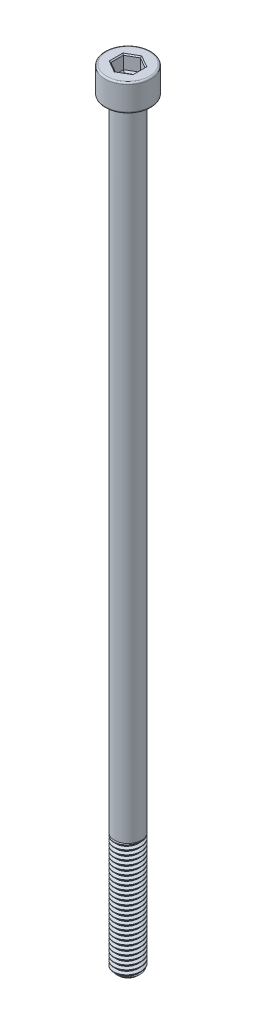
from build123d import *

# Parameters (mm, degrees)
SKETCH1_R           = 2.5
BOSS_EXTRUDE1_DEPTH = 22
THREAD1_PITCH       = 0.8
SKETCH2_R           = 2.5
BOSS_EXTRUDE2_DEPTH = 118
SKETCH3_R           = 4.25
BOSS_EXTRUDE3_DEPTH = 5
FILLET1_R           = 0.3
CUT_EXTRUDE1_DEPTH  = 2.5
CHAMFER1_SIZE       = 0.2
CUT_EXTRUDE2_DEPTH  = 0.3
CUT_EXTRUDE2_DRAFT  = -45


with BuildPart() as part:
    # Sketch1 → Boss-Extrude1 (new body)
    with BuildSketch(Plane(origin=(0, 0, 0), x_dir=(1, 0, 0), z_dir=(0, 1, 0))):
        with Locations(Location((0, 0, 0), (0, 0, 270))):
            Circle(SKETCH1_R)
    extrude(amount=BOSS_EXTRUDE1_DEPTH)

    # Thread1: the profile of Thread Profile1 profile screwed along a right-hand helix of 28.75 turns, 8 arcs to a turn; built about Z, then put on its axis
    thread1_z = Axis((0, 0, 0), (0, 0, 1))
    thread1_corners = [(2.5003, 0, -0.000173205), (2.5003, 0, 0.700173203), (2.0669873, 0, 0.449999999), (2.0669873, 0, 0.249999999)]
    with BuildLine(mode=Mode.PRIVATE) as thread1_profile:
        Line(thread1_corners[0], thread1_corners[1])
        Line(thread1_corners[1], thread1_corners[2])
        Line(thread1_corners[2], thread1_corners[3])
        Line(thread1_corners[3], thread1_corners[0])
    thread1_cap = Face(thread1_profile.wire())
    thread1_turn_angles = [0, 22.5, 45, 67.5, 90, 112.5, 135, 157.5, 180, 202.5, 225, 247.5, 270, 292.5, 315, 337.5, 360]
    thread1_turn_weights = [1, 0.9238795325112867, 1, 0.9238795325112867, 1, 0.9238795325112867, 1, 0.9238795325112867, 1, 0.9238795325112867, 1, 0.9238795325112867, 1, 0.9238795325112867, 1, 0.9238795325112867, 1]
    thread1_turn_rails = [Edge.make_bspline([Vector(p[0], p[1], 0).rotate(thread1_z, thread1_turn_angles[k]) / thread1_turn_weights[k] + Vector(0, 0, p[2] + THREAD1_PITCH * thread1_turn_angles[k] / 360) for k in range(17)], [0, 0, 0, 1, 1, 2, 2, 3, 3, 4, 4, 5, 5, 6, 6, 7, 7, 8, 8, 8], 2, thread1_turn_weights) for p in thread1_corners]
    thread1_turn_sides = [Face.make_surface_from_curves(thread1_turn_rails[p[0]], thread1_turn_rails[p[1]]) for p in [(0, 1), (1, 2), (2, 3), (3, 0)]]
    thread1_last_angles = [10080, 10102.5, 10125, 10147.5, 10170, 10192.5, 10215, 10237.5, 10260, 10282.5, 10305, 10327.5, 10350]
    thread1_last_weights = [1, 0.9238795325112867, 1, 0.9238795325112867, 1, 0.9238795325112867, 1, 0.9238795325112867, 1, 0.9238795325112867, 1, 0.9238795325112867, 1]
    thread1_last_rails = [Edge.make_bspline([Vector(p[0], p[1], 0).rotate(thread1_z, thread1_last_angles[k]) / thread1_last_weights[k] + Vector(0, 0, p[2] + THREAD1_PITCH * thread1_last_angles[k] / 360) for k in range(13)], [0, 0, 0, 1, 1, 2, 2, 3, 3, 4, 4, 5, 5, 6, 6, 6], 2, thread1_last_weights) for p in thread1_corners]
    thread1_last_sides = [Face.make_surface_from_curves(thread1_last_rails[p[0]], thread1_last_rails[p[1]]) for p in [(0, 1), (1, 2), (2, 3), (3, 0)]]
    thread1 = Plane(origin=(0, 23, 0), x_dir=(-1, 0, 0), z_dir=(0, -1, 0)) * Solid(Shell([*[p.moved(Location((0, 0, THREAD1_PITCH * i))) for i in range(28) for p in thread1_turn_sides], *thread1_last_sides, thread1_cap, thread1_cap.rotate(thread1_z, 10350).moved(Location((0, 0, THREAD1_PITCH * 10350 / 360)))]))
    add(thread1, mode=Mode.SUBTRACT)

    # Sketch2 → Boss-Extrude2 (add)
    with BuildSketch(Plane(origin=(0, 22, 0), x_dir=(1, 0, 0), z_dir=(0, 1, 0))):
        with Locations(Location((0, 0, 0), (0, 0, 90))):
            Circle(SKETCH2_R)
    extrude(amount=BOSS_EXTRUDE2_DEPTH)

    # Sketch3 → Boss-Extrude3 (add)
    with BuildSketch(Plane(origin=(0, 140, 0), x_dir=(1, 0, 0), z_dir=(0, 1, 0))):
        with Locations(Location((0, 0, 0), (0, 0, 270))):
            Circle(SKETCH3_R)
    extrude(amount=BOSS_EXTRUDE3_DEPTH)

    # Fillet1
    fillet1_edges = [part.edges().sort_by_distance(p)[0] for p in [
        (0, 140, -4.25),
        (0, 145, -4.25),
    ]]
    fillet(fillet1_edges, radius=FILLET1_R)

    # Sketch4 → Cut-Revolve1 (revolve, cut)
    with BuildSketch(Plane.XY, mode=Mode.PRIVATE) as cut_revolve1_sk:
        Polygon((2.51, 0), (2.51, 0.7), (1.81, 0), align=None)
    revolve(cut_revolve1_sk.sketch.rotate(Axis((0, 0, 0), (0, 1, 0)), 90), axis=Axis((0, 0, 0), (0, 1, 0)), mode=Mode.SUBTRACT)

    # Sketch5 → Cut-Extrude1 (cut)
    with BuildSketch(Plane(origin=(0, 145, 0), x_dir=(1, 0, 0), z_dir=(0, 1, 0))):
        Polygon((0, 2.309401077), (-2, 1.154700538), (-2, -1.154700538), (0, -2.309401077), (2, -1.154700538), (2, 1.154700538), align=None)
    extrude(amount=-CUT_EXTRUDE1_DEPTH, mode=Mode.SUBTRACT)

    # Chamfer1
    chamfer1_edges = [part.edges().sort_by_distance(p)[0] for p in [
        (1, 145, -1.732050808),
        (-1, 145, -1.732050808),
        (-2, 145, 0),
        (-1, 145, 1.732050808),
        (1, 145, 1.732050808),
        (2, 145, 0),
    ]]
    chamfer(chamfer1_edges, length=CHAMFER1_SIZE)


with BuildPart() as cut_extrude2_tool:
    # Sketch6 → Cut-Extrude2 (with draft: the straight prism first)
    with BuildSketch(Plane(origin=(0, 142.5, 0), x_dir=(1, 0, 0), z_dir=(0, 1, 0))):
        Polygon((0, 2.309401077), (-2, 1.154700538), (-2, -1.154700538), (0, -2.309401077), (2, -1.154700538), (2, 1.154700538), align=None)
    extrude(amount=-CUT_EXTRUDE2_DEPTH)
    # Cut-Extrude2: the draft: its side faces are tilted about the plane it starts from
    cut_extrude2_sides = [cut_extrude2_tool.faces().sort_by_distance(p)[0] for p in [
        (-1, 142.35, -1.732050808),
        (-2, 142.35, 0),
        (-1, 142.35, 1.732050808),
        (1, 142.35, 1.732050808),
        (2, 142.35, 0),
        (1, 142.35, -1.732050808),
    ]]
    draft(cut_extrude2_sides, Plane(origin=(0, 142.5, 0), x_dir=(1, 0, 0), z_dir=(0, 1, 0)), CUT_EXTRUDE2_DRAFT)


with BuildPart() as part_1:
    add(part.part)

    # Cut-Extrude2: cut by cut_extrude2_tool
    add(cut_extrude2_tool.part, mode=Mode.SUBTRACT)


solid = part_1.part
